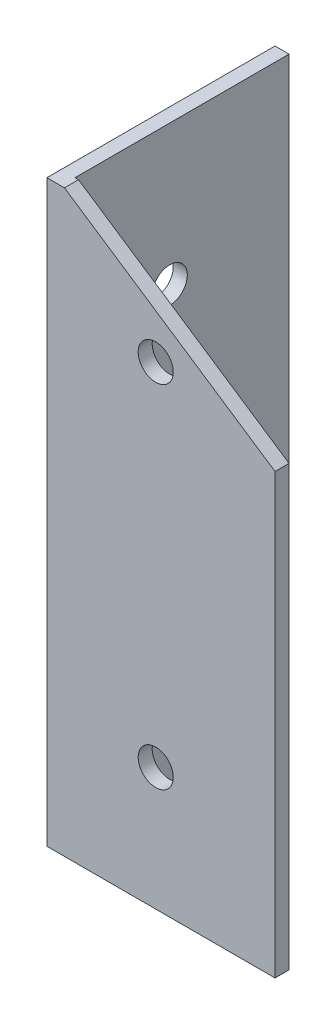
from build123d import *

# Parameters (mm, degrees)
EXTRUDE_1_DEPTH     = 165
SKETCH_2_R          = 5
CUT_EXTRUDE_1_DEPTH = 10
SKETCH_3_R          = 5
CUT_EXTRUDE_2_DEPTH = 10
CUT_EXTRUDE_3_DEPTH = 189.878267675


with BuildPart() as part:
    # Эскиз1 → Вытянуть-Тонкостенный1 (new body)
    with BuildSketch(Plane(origin=(0, 0, 0), x_dir=(1, 0, 0), z_dir=(0, 1, 0))):
        Polygon((0, 65), (0, 0), (65, 0), (65, 4), (4, 4), (4, 65), align=None)
    extrude(amount=EXTRUDE_1_DEPTH)

    # Эскиз2 → Вырез-Вытянуть1 (cut)
    with BuildSketch(Plane.XY):
        with Locations((31, 235)):
            Circle(SKETCH_2_R)
        with Locations((31, 135)):
            Circle(SKETCH_2_R)
        with Locations((31, 35)):
            Circle(SKETCH_2_R)
    extrude(amount=-CUT_EXTRUDE_1_DEPTH, mode=Mode.SUBTRACT)

    # Эскиз3 → Вырез-Вытянуть2 (cut)
    with BuildSketch(Plane.ZY):
        with Locations((-31, 225)):
            Circle(SKETCH_3_R)
        with Locations((-31, 125)):
            Circle(SKETCH_3_R)
        with Locations((-31, 25)):
            Circle(SKETCH_3_R)
    extrude(amount=-CUT_EXTRUDE_2_DEPTH, mode=Mode.SUBTRACT)

    # Эскиз4 → Вырез-Вытянуть3 (cut, through all)
    with BuildSketch(Plane.XY):
        Polygon((5, 165), (65, 125), (65, 165), align=None)
    extrude(amount=-CUT_EXTRUDE_3_DEPTH, mode=Mode.SUBTRACT)


solid = part.part
